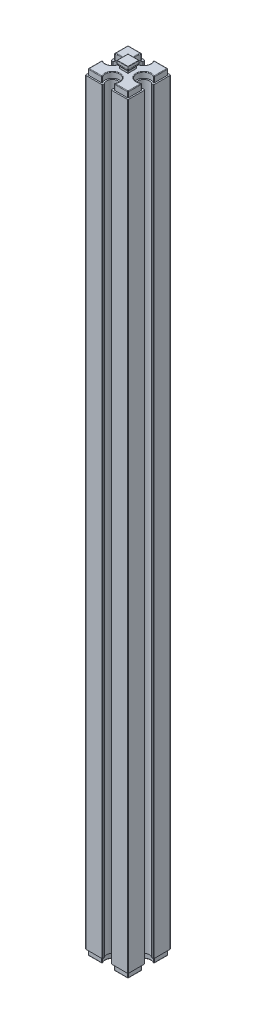
from build123d import *

# Parameters (mm, degrees)
EXTRUDE_1_DEPTH        = 133
EXTRUDE_2_DEPTH        = 2
EXTRUDE_3_DEPTH        = 2
FILLET_3_R             = 0.2
CUT_EXTRUDE_1_DEPTH    = 3
FILLET_4_R             = 0.2
FILLET_5_R             = 0.1
FILLET_3_OF_MIRROR_1_R = 0.2
FILLET_4_OF_MIRROR_1_R = 0.2
FILLET_5_OF_MIRROR_1_R = 0.1


with BuildPart() as part:
    # 草图1 → 凸台-拉伸1 (new body)
    with BuildSketch(Plane(origin=(0, 0, 0), x_dir=(1, 0, 0), z_dir=(0, 1, 0))):
        with BuildLine():
            Line((-7.5, 7.5), (-1.5, 7.5))
            Line((-1.5, 7.5), (-1.5, 6.822875656))
            ThreePointArc((-1.5, 6.822875656), (0, 3.5), (1.5, 6.822875656))
            Line((1.5, 6.822875656), (1.5, 7.5))
            Line((1.5, 7.5), (7.5, 7.5))
            Line((7.5, 7.5), (7.5, 1.5))
            Line((7.5, 1.5), (6.822875656, 1.5))
            ThreePointArc((6.822875656, 1.5), (3.5, 0), (6.822875656, -1.5))
            Line((6.822875656, -1.5), (7.5, -1.5))
            Line((7.5, -1.5), (7.5, -7.5))
            Line((7.5, -7.5), (1.5, -7.5))
            Line((1.5, -7.5), (1.5, -6.822875656))
            ThreePointArc((1.5, -6.822875656), (0, -3.5), (-1.5, -6.822875656))
            Line((-1.5, -6.822875656), (-1.5, -7.5))
            Line((-1.5, -7.5), (-7.5, -7.5))
            Line((-7.5, -7.5), (-7.5, -1.5))
            Line((-7.5, -1.5), (-6.822875656, -1.5))
            ThreePointArc((-6.822875656, -1.5), (-3.5, 0), (-6.822875656, 1.5))
            Line((-6.822875656, 1.5), (-7.5, 1.5))
            Line((-7.5, 1.5), (-7.5, 7.5))
        make_face()
    extrude_1 = extrude(amount=EXTRUDE_1_DEPTH)

    # 草图2 → 凸台-拉伸2 (add)
    with BuildSketch(Plane(origin=(0, 133, 0), x_dir=(1, 0, 0), z_dir=(0, 1, 0))):
        with BuildLine():
            Line((-7, 7), (-7, 2))
            ThreePointArc((-7, 2), (-3, 0), (-7, -2))
            Line((-7, -2), (-7, -7))
            Line((-7, -7), (-2, -7))
            ThreePointArc((-2, -7), (0, -3), (2, -7))
            Line((2, -7), (7, -7))
            Line((7, -7), (7, -2))
            ThreePointArc((7, -2), (3, 0), (7, 2))
            Line((7, 2), (7, 7))
            Line((7, 7), (2, 7))
            ThreePointArc((2, 7), (0, 3), (-2, 7))
            Line((-2, 7), (-7, 7))
        make_face()
    extrude_2 = extrude(amount=EXTRUDE_2_DEPTH)

    # 草图3 → 凸台-拉伸3 (add, symmetric)
    with BuildSketch(Plane(origin=(0, 0, 0), x_dir=(0, 0, -1), z_dir=(1, 0, 0))):
        with BuildLine():
            Line((-1.5, 135), (1.5, 135))
            Line((1.5, 135), (1.5, 135.677124344))
            ThreePointArc((1.5, 135.677124344), (1.780042303, 136.088161527), (1.95, 136.555590279))
            Line((1.95, 136.555590279), (1.95, 137.5))
            Line((1.95, 137.5), (-1.95, 137.5))
            Line((-1.95, 137.5), (-1.95, 136.555590279))
            ThreePointArc((-1.95, 136.555590279), (-1.780042303, 136.088161527), (-1.5, 135.677124344))
            Line((-1.5, 135.677124344), (-1.5, 135))
        make_face()
    extrude_3 = extrude(amount=EXTRUDE_3_DEPTH, both=True)

    # 圆角3
    fillet_3_edges = [part.edges().sort_by_distance(p)[0] for p in [
        (-7.5, 66.5, -7.5),
        (-1.5, 66.5, -7.5),
        (1.5, 66.5, -7.5),
        (7.5, 66.5, -7.5),
        (7.5, 66.5, -1.5),
        (7.5, 66.5, 1.5),
        (7.5, 66.5, 7.5),
        (1.5, 66.5, 7.5),
        (-1.5, 66.5, 7.5),
        (-7.5, 66.5, 7.5),
        (-7.5, 66.5, 1.5),
        (-6.822875656, 66.5, -1.5),
        (-7.5, 66.5, -1.5),
    ]]
    fillet(fillet_3_edges, radius=FILLET_3_R)

    # 草图4 → 切除-拉伸1 (cut, symmetric)
    with BuildSketch(Plane.XY):
        with BuildLine():
            Line((1.95, 137.5), (2, 137.5))
            Line((2, 137.5), (2, 135))
            Line((2, 135), (1.5, 135))
            Line((1.5, 135), (1.5, 135.677124344))
            ThreePointArc((1.5, 135.677124344), (1.780042303, 136.088161527), (1.95, 136.555590279))
            Line((1.95, 136.555590279), (1.95, 137.5))
        make_face()
        with BuildLine():
            Line((-1.95, 137.5), (-1.95, 136.555590279))
            ThreePointArc((-1.95, 136.555590279), (-1.780042303, 136.088161527), (-1.5, 135.677124344))
            Line((-1.5, 135.677124344), (-1.5, 135))
            Line((-1.5, 135), (-2, 135))
            Line((-2, 135), (-2, 137.5))
            Line((-2, 137.5), (-1.95, 137.5))
        make_face()
    cut_extrude_1 = extrude(amount=CUT_EXTRUDE_1_DEPTH, both=True, mode=Mode.SUBTRACT)

    # 圆角4
    fillet_4_edges = [part.edges().sort_by_distance(p)[0] for p in [
        (-2, 134, -7),
        (-7, 134, -7),
        (-7, 134, -2),
        (-7, 134, 2),
        (-7, 134, 7),
        (-2, 134, 7),
        (2, 134, 7),
        (7, 134, 7),
        (7, 134, 2),
        (7, 134, -2),
        (7, 134, -7),
        (2, 134, -7),
        (-4.5, 135, -7),
        (-7, 135, -4.5),
        (-3, 135, 0),
        (-7, 135, 4.5),
        (-4.5, 135, 7),
        (0, 135, 3),
        (4.5, 135, 7),
        (7, 135, 4.5),
        (3, 135, 0),
        (7, 135, -4.5),
        (4.5, 135, -7),
        (0, 135, -3),
    ]]
    fillet(fillet_4_edges, radius=FILLET_4_R)

    # 圆角5
    fillet_5_edges = [part.edges().sort_by_distance(p)[0] for p in [
        (1.95, 137.5, 0),
        (0, 137.5, -1.95),
        (0, 137.5, 1.95),
        (-1.95, 137.5, 0),
    ]]
    fillet(fillet_5_edges, radius=FILLET_5_R)

    # 镜向1: 凸台-拉伸1, 凸台-拉伸2, 凸台-拉伸3, 切除-拉伸1 across Top Plane
    add(extrude_1.mirror(Plane(origin=(0, 0, 0), x_dir=(1, 0, 0), z_dir=(0, 1, 0))))
    add(extrude_2.mirror(Plane(origin=(0, 0, 0), x_dir=(1, 0, 0), z_dir=(0, 1, 0))))
    add(extrude_3.mirror(Plane(origin=(0, 0, 0), x_dir=(1, 0, 0), z_dir=(0, 1, 0))))
    add(cut_extrude_1.mirror(Plane(origin=(0, 0, 0), x_dir=(1, 0, 0), z_dir=(0, 1, 0))), mode=Mode.SUBTRACT)

    # 圆角3 of 镜向1
    fillet_3_of_mirror_1_edges = [part.edges().sort_by_distance(p)[0] for p in [
        (-7.5, -66.5, -7.5),
        (-1.5, -66.5, -7.5),
        (1.5, -66.5, -7.5),
        (7.5, -66.5, -7.5),
        (7.5, -66.5, -1.5),
        (7.5, -66.5, 1.5),
        (7.5, -66.5, 7.5),
        (1.5, -66.5, 7.5),
        (-1.5, -66.5, 7.5),
        (-7.5, -66.5, 7.5),
        (-7.5, -66.5, 1.5),
        (-6.822875656, -66.5, -1.5),
        (-7.5, -66.5, -1.5),
    ]]
    fillet(fillet_3_of_mirror_1_edges, radius=FILLET_3_OF_MIRROR_1_R)

    # 圆角4 of 镜向1
    fillet_4_of_mirror_1_edges = [part.edges().sort_by_distance(p)[0] for p in [
        (-2, -134, -7),
        (-7, -134, -7),
        (-7, -134, -2),
        (-7, -134, 2),
        (-7, -134, 7),
        (-2, -134, 7),
        (2, -134, 7),
        (7, -134, 7),
        (7, -134, 2),
        (7, -134, -2),
        (7, -134, -7),
        (2, -134, -7),
        (-4.5, -135, -7),
        (-7, -135, -4.5),
        (-3, -135, 0),
        (-7, -135, 4.5),
        (-4.5, -135, 7),
        (0, -135, 3),
        (4.5, -135, 7),
        (7, -135, 4.5),
        (3, -135, 0),
        (7, -135, -4.5),
        (4.5, -135, -7),
        (0, -135, -3),
    ]]
    fillet(fillet_4_of_mirror_1_edges, radius=FILLET_4_OF_MIRROR_1_R)

    # 圆角5 of 镜向1
    fillet_5_of_mirror_1_edges = [part.edges().sort_by_distance(p)[0] for p in [
        (1.95, -137.5, 0),
        (0, -137.5, -1.95),
        (0, -137.5, 1.95),
        (-1.95, -137.5, 0),
    ]]
    fillet(fillet_5_of_mirror_1_edges, radius=FILLET_5_OF_MIRROR_1_R)


solid = part.part
